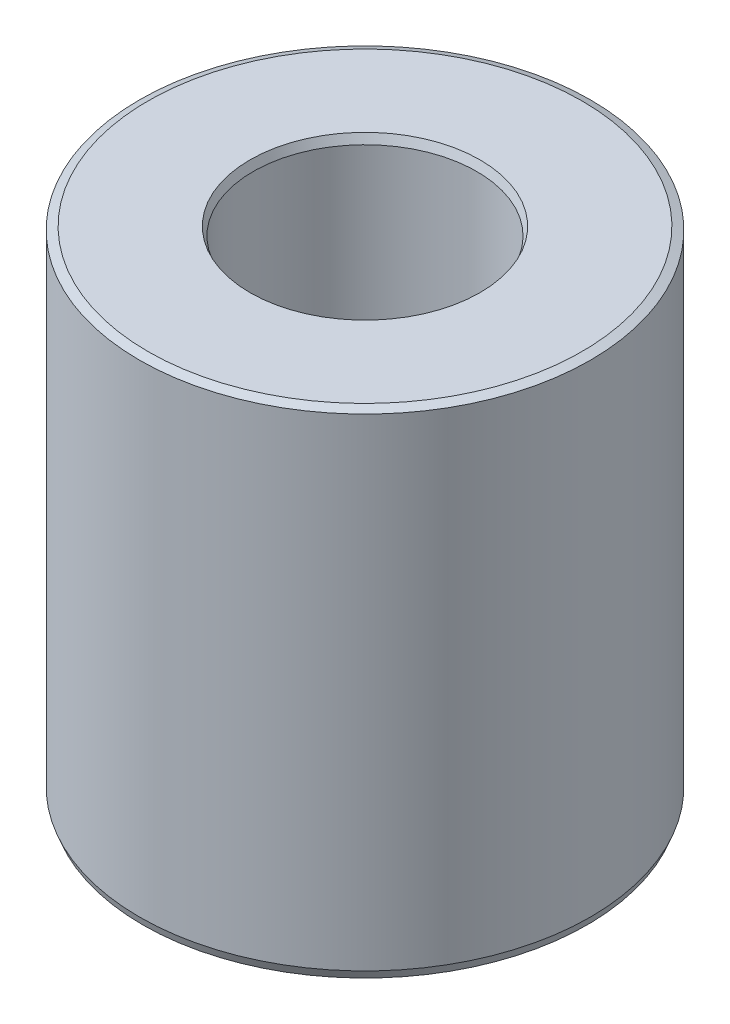
from build123d import *
from OCP.BRepFilletAPI import BRepFilletAPI_MakeChamfer

# Parameters (mm, degrees)
SKETCH1_R           = 47.5
BOSS_EXTRUDE1_DEPTH = 104.050931708
SKETCH2_R           = 23.549129783
CUT_EXTRUDE1_DEPTH  = 124.851105725
CHAMFER1_SIZE       = 0.684351143
CHAMFER1_SIZE2      = 1.779927512


with BuildPart() as part:
    # Sketch1 → Boss-Extrude1 (new body)
    with BuildSketch(Plane(origin=(0, 0, 0), x_dir=(1, 0, 0), z_dir=(0, 1, 0))):
        Circle(SKETCH1_R)
    extrude(amount=BOSS_EXTRUDE1_DEPTH)

    # Sketch2 → Cut-Extrude1 (cut, through all)
    with BuildSketch(Plane(origin=(0, 0, 0), x_dir=(1, 0, 0), z_dir=(0, 1, 0))):
        Circle(SKETCH2_R)
    extrude(amount=CUT_EXTRUDE1_DEPTH, mode=Mode.SUBTRACT)

    # Chamfer1: one chamfer whose edges measure the first distance from different faces: ONE call of the kernel's chamfer builder (chamfer() names one face for all edges)
    chamfer1_edges_1 = [part.edges().sort_by_distance(p)[0] for p in [
        (-23.549129783, 104.050931708, 0),
    ]]
    chamfer1_side_1 = [part.faces().sort_by_distance(p)[0] for p in [
        (-46.156497116, 104.050931708, 0),
    ]]
    chamfer1_edges_2 = [part.edges().sort_by_distance(p)[0] for p in [
        (-23.549129783, 0, 0),
    ]]
    chamfer1_side_2 = [part.faces().sort_by_distance(p)[0] for p in [
        (-23.549129783, 52.025465854, 0),
    ]]
    chamfer1_edges_3 = [part.edges().sort_by_distance(p)[0] for p in [
        (-47.5, 0, 0),
    ]]
    chamfer1_side_3 = [part.faces().sort_by_distance(p)[0] for p in [
        (-46.156497116, 0, 0),
    ]]
    chamfer1_edges_4 = [part.edges().sort_by_distance(p)[0] for p in [
        (-47.5, 104.050931708, 0),
    ]]
    chamfer1_side_4 = [part.faces().sort_by_distance(p)[0] for p in [
        (-47.5, 52.025465854, 0),
    ]]
    chamfer1 = BRepFilletAPI_MakeChamfer(part.part.solid().wrapped)
    for e in chamfer1_edges_1:
        chamfer1.Add(CHAMFER1_SIZE, CHAMFER1_SIZE2, e.wrapped, chamfer1_side_1[0].wrapped)  # the first distance lies on this face
    for e in chamfer1_edges_2:
        chamfer1.Add(CHAMFER1_SIZE, CHAMFER1_SIZE2, e.wrapped, chamfer1_side_2[0].wrapped)  # the first distance lies on this face
    for e in chamfer1_edges_3:
        chamfer1.Add(CHAMFER1_SIZE, CHAMFER1_SIZE2, e.wrapped, chamfer1_side_3[0].wrapped)  # the first distance lies on this face
    for e in chamfer1_edges_4:
        chamfer1.Add(CHAMFER1_SIZE, CHAMFER1_SIZE2, e.wrapped, chamfer1_side_4[0].wrapped)  # the first distance lies on this face
    add(Compound.cast(chamfer1.Shape()), mode=Mode.REPLACE)


solid = part.part
